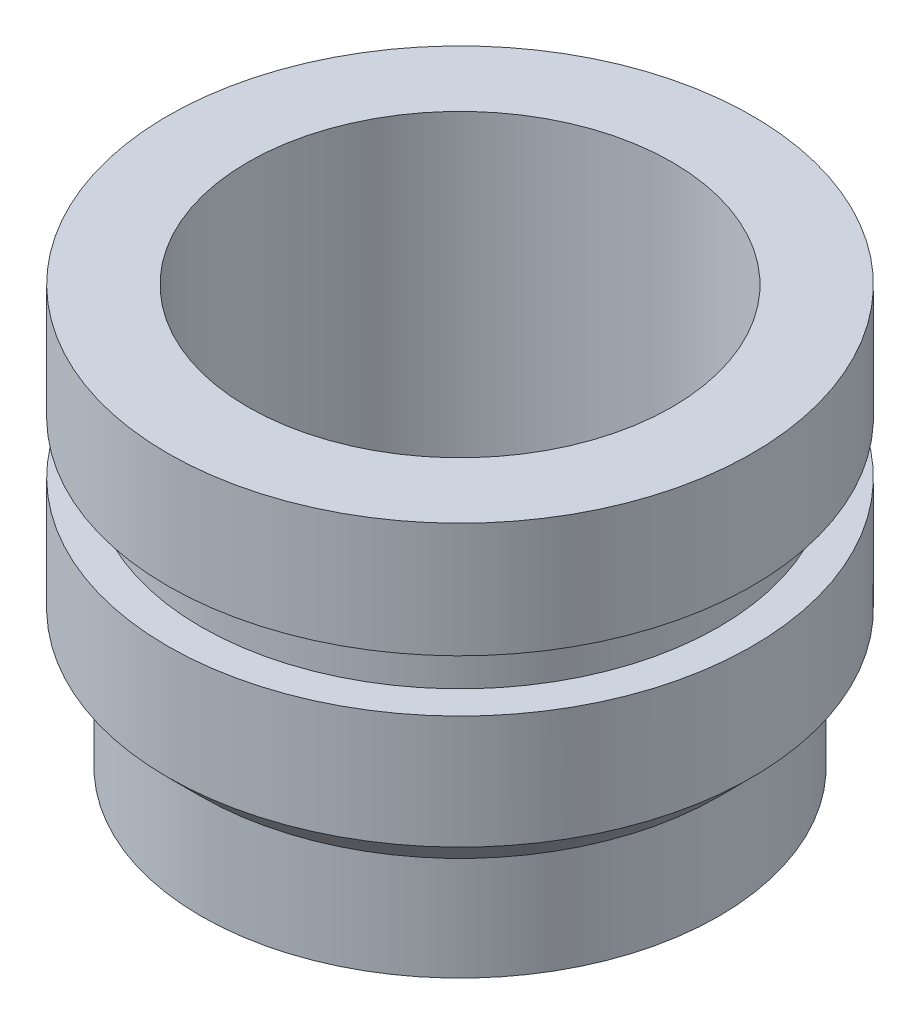
from build123d import *

# Parameters (mm, degrees)
SKETCH1_R           = 1.750000056
SKETCH1_R_2         = 1.27
BOSS_EXTRUDE1_DEPTH = 2.50000008
CUT_EXTRUDE1_START  = -0.31250001
SKETCH2_R           = 1.750000056
SKETCH2_R_2         = 1.549999948
CUT_EXTRUDE1_DEPTH  = 0.31250001
CHAMFER1_SIZE       = 0.508
CUT_EXTRUDE2_START  = -1.81250001
SKETCH2_2_R         = 1.750000056
SKETCH2_2_R_2       = 1.549999948
CUT_EXTRUDE2_DEPTH  = 0.31250001


with BuildPart() as part:
    # Sketch1 → Boss-Extrude1 (new body)
    with BuildSketch(Plane(origin=(0, 0, 0), x_dir=(1, 0, 0), z_dir=(0, 1, 0))):
        with Locations(Location((0, 0, 0), (0, 0, 270))):
            Circle(SKETCH1_R)
        with Locations(Location((0, 0, 0), (0, 0, 270))):
            Circle(SKETCH1_R_2, mode=Mode.SUBTRACT)
    extrude(amount=-BOSS_EXTRUDE1_DEPTH)

    # Sketch2 → Cut-Extrude1 (cut)
    with BuildSketch(Plane.XZ.offset(2.50000008).offset(CUT_EXTRUDE1_START)):
        with Locations(Location((0, 0, 0), (0, 0, 90))):
            Circle(SKETCH2_R)
        with Locations(Location((0, 0, 0), (0, 0, 270))):
            Circle(SKETCH2_R_2, mode=Mode.SUBTRACT)
    extrude(amount=CUT_EXTRUDE1_DEPTH, mode=Mode.SUBTRACT)

    # Chamfer1
    # the kernel refuses this chamfer: 0.508 mm, written as the material it takes off along each edge
    with BuildSketch(Plane(origin=(0, -2.18750007, 0), x_dir=(0, 0, 1), z_dir=(1, 0, 0))) as chamfer1_piece_1_section:
        Polygon((1.750000056, -CHAMFER1_SIZE), (1.750000056 - CHAMFER1_SIZE, 0), (1.750000056, 0), align=None)
    chamfer1_piece_1 = revolve(axis=Axis((0, -2.18750007, 0), (0, -1, 0)), mode=Mode.PRIVATE)
    chamfer1_piece_1 = chamfer1_piece_1 - Plane(origin=(0, -1.779243364, 0), x_dir=(0, 0, -1), z_dir=(0, 1, 0)) * Cylinder(1.549999948, 8, mode=Mode.PRIVATE)
    add(chamfer1_piece_1, mode=Mode.SUBTRACT)

    # Sketch2<2> → Cut-Extrude2 (cut)
    with BuildSketch(Plane.XZ.offset(2.50000008).offset(CUT_EXTRUDE2_START)):
        with Locations(Location((0, 0, 0), (0, 0, 90))):
            Circle(SKETCH2_2_R)
        with Locations(Location((0, 0, 0), (0, 0, 270))):
            Circle(SKETCH2_2_R_2, mode=Mode.SUBTRACT)
    extrude(amount=CUT_EXTRUDE2_DEPTH, mode=Mode.SUBTRACT)


solid = part.part
